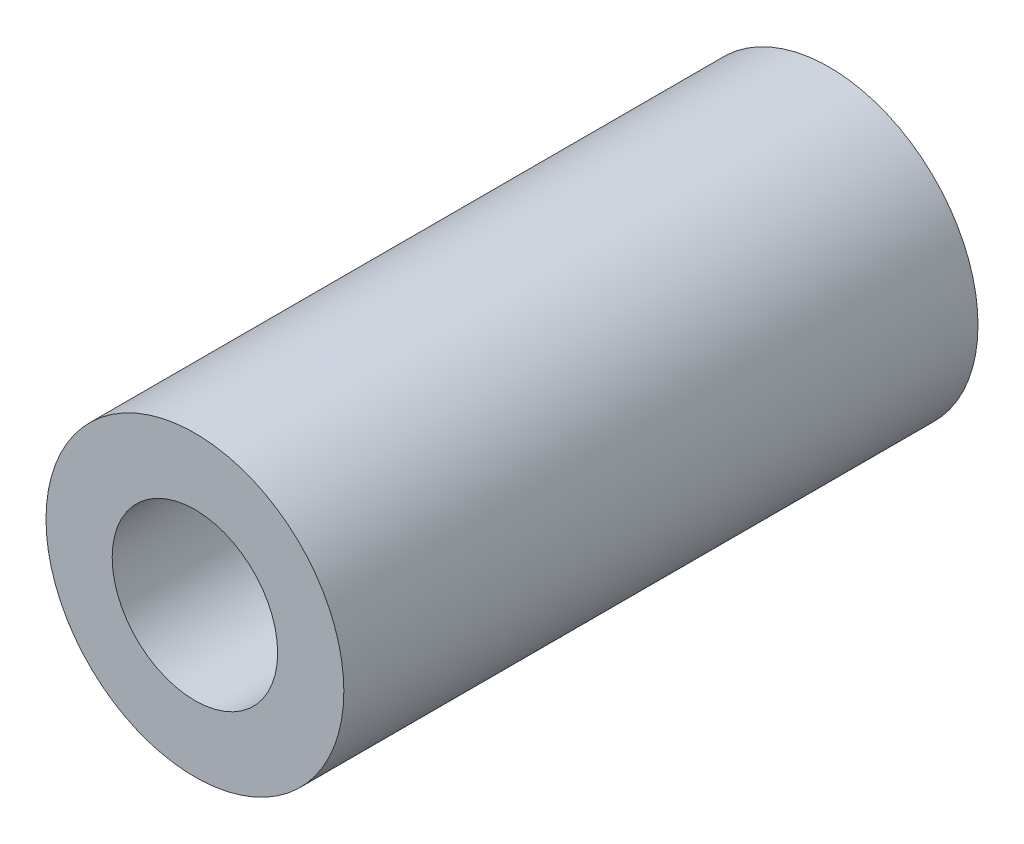
from build123d import *

# Parameters (mm, degrees)
SKETCH1_R      = 4.5
SKETCH1_R_2    = 2.5
EXTRUDE1_DEPTH = 19.163


with BuildPart() as part:
    # Sketch1 → Extrude1 (new body)
    with BuildSketch(Plane.XY):
        Circle(SKETCH1_R)
        Circle(SKETCH1_R_2, mode=Mode.SUBTRACT)
    extrude(amount=EXTRUDE1_DEPTH)


solid = part.part
